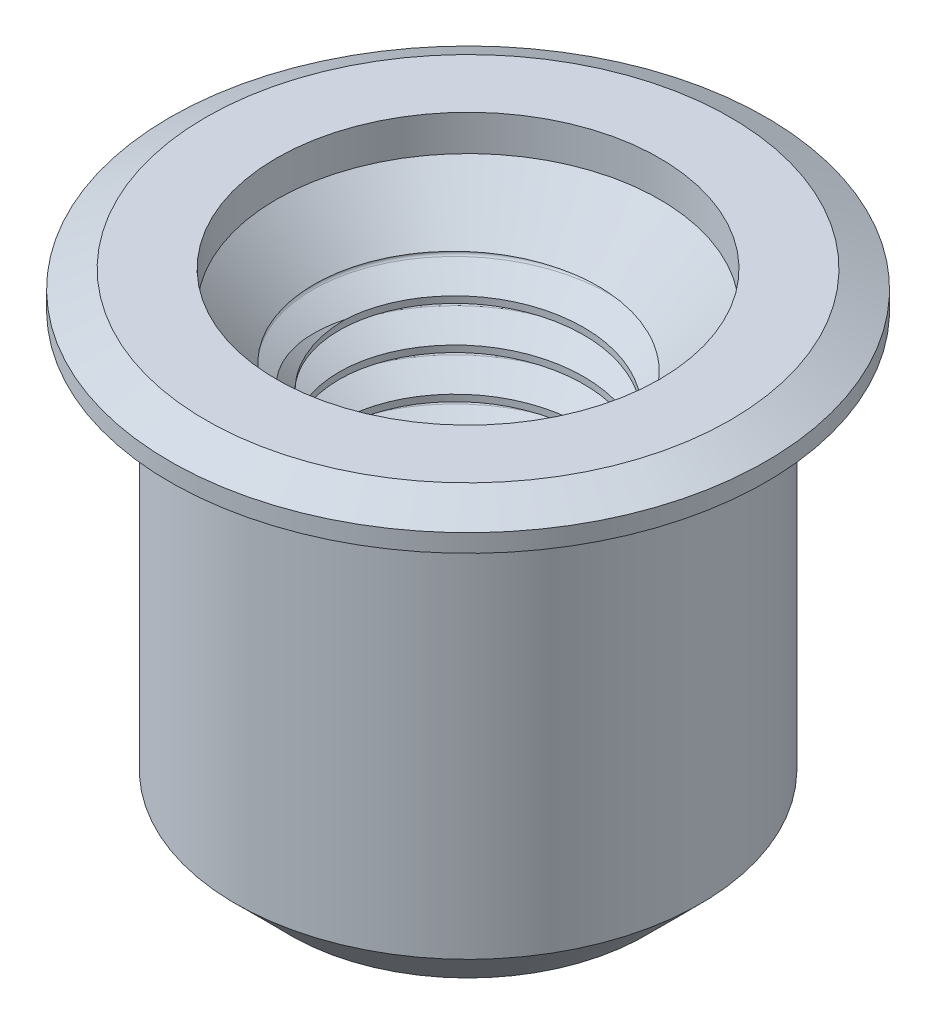
from build123d import *

# Parameters (mm, degrees)
CUT_SWEEP1_PITCH = 0.907142857


with BuildPart() as part:
    # Sketch1 → Revolve1 (revolve)
    with BuildSketch(Plane.XY):
        Polygon((-4.953, -9.241517857), (-3.780517857, -10.414), (-3.175, -10.414), (-2.608035714, -9.847035714), (-2.608035714, -2.236107143), (-4.082142857, -0.762), (-4.082142857, 0), (-5.588, 0), (-6.35, -0.381), (-6.35, -0.762), (-4.953, -0.762), align=None)
    revolve(axis=Axis((0, 0, 0), (0, -1, 0)))

    # Cut-Sweep1: the profile of Sketch4 screwed along a right-hand helix of 20.436459 turns, 8 arcs to a turn; built about Z, then put on its axis
    cut_sweep1_z = Axis((0, 0, 0), (0, 0, 1))
    cut_sweep1_corners = [(2.536692883, 0, 0.368526786), (2.536692883, 0, -0.481919643), (3.175, 0, -0.113392857), (3.207733698, 0, -0.056696429), (3.175, 0, 0)]
    with BuildLine(mode=Mode.PRIVATE) as cut_sweep1_profile:
        Line(cut_sweep1_corners[0], cut_sweep1_corners[1])
        Line(cut_sweep1_corners[1], cut_sweep1_corners[2])
        Line(cut_sweep1_corners[4], cut_sweep1_corners[0])
        ThreePointArc((3.175, 0, -0.113392857), (3.19896273, 0, -0.089430127), (3.207733698, 0, -0.056696429))
        ThreePointArc((3.207733698, 0, -0.056696429), (3.19896273, 0, -0.02396273), (3.175, 0, 0))
    cut_sweep1_cap = Face(cut_sweep1_profile.wire())
    cut_sweep1_arcs = [((3.175, 0, -0.113392857), (3.207733698, 0, -0.094494048), (3.207733698, 0, -0.056696429), (1, 0.86602540378445, 1)), ((3.207733698, 0, -0.056696429), (3.207733698, 0, -0.01889881), (3.175, 0, 0), (1, 0.86602540378445, 1))]  # start, shoulder, end, weights
    cut_sweep1_turn_angles = [0, 22.5, 45, 67.5, 90, 112.5, 135, 157.5, 180, 202.5, 225, 247.5, 270, 292.5, 315, 337.5, 360]
    cut_sweep1_turn_weights = [1, 0.9238795325112867, 1, 0.9238795325112867, 1, 0.9238795325112867, 1, 0.9238795325112867, 1, 0.9238795325112867, 1, 0.9238795325112867, 1, 0.9238795325112867, 1, 0.9238795325112867, 1]
    cut_sweep1_turn_rails = [Edge.make_bspline([Vector(p[0], p[1], 0).rotate(cut_sweep1_z, cut_sweep1_turn_angles[k]) / cut_sweep1_turn_weights[k] + Vector(0, 0, p[2] + CUT_SWEEP1_PITCH * cut_sweep1_turn_angles[k] / 360) for k in range(17)], [0, 0, 0, 1, 1, 2, 2, 3, 3, 4, 4, 5, 5, 6, 6, 7, 7, 8, 8, 8], 2, cut_sweep1_turn_weights) for p in cut_sweep1_corners]
    cut_sweep1_turn_sides = [*[Face.make_surface_from_curves(cut_sweep1_turn_rails[p[0]], cut_sweep1_turn_rails[p[1]]) for p in [(0, 1), (1, 2), (4, 0)]], *[Face.make_bezier_surface([[Vector(p[j][0], p[j][1], 0).rotate(cut_sweep1_z, cut_sweep1_turn_angles[2 * i + k]) / cut_sweep1_turn_weights[2 * i + k] + Vector(0, 0, p[j][2] + CUT_SWEEP1_PITCH * cut_sweep1_turn_angles[2 * i + k] / 360) for k in range(3)] for j in range(3)], [[p[3][j] * cut_sweep1_turn_weights[2 * i + k] for k in range(3)] for j in range(3)]) for p in cut_sweep1_arcs for i in range(8)]]
    cut_sweep1_last_angles = [7200, 7222.5, 7245, 7267.5, 7290, 7312.5, 7335, 7346.062697408, 7357.125394816]
    cut_sweep1_last_weights = [1, 0.9238795325112867, 1, 0.9238795325112867, 1, 0.9238795325112867, 1, 0.9814177980271717, 1]
    cut_sweep1_last_rails = [Edge.make_bspline([Vector(p[0], p[1], 0).rotate(cut_sweep1_z, cut_sweep1_last_angles[k]) / cut_sweep1_last_weights[k] + Vector(0, 0, p[2] + CUT_SWEEP1_PITCH * cut_sweep1_last_angles[k] / 360) for k in range(9)], [0, 0, 0, 1, 1, 2, 2, 3, 3, 4, 4, 4], 2, cut_sweep1_last_weights) for p in cut_sweep1_corners]
    cut_sweep1_last_sides = [*[Face.make_surface_from_curves(cut_sweep1_last_rails[p[0]], cut_sweep1_last_rails[p[1]]) for p in [(0, 1), (1, 2), (4, 0)]], *[Face.make_bezier_surface([[Vector(p[j][0], p[j][1], 0).rotate(cut_sweep1_z, cut_sweep1_last_angles[2 * i + k]) / cut_sweep1_last_weights[2 * i + k] + Vector(0, 0, p[j][2] + CUT_SWEEP1_PITCH * cut_sweep1_last_angles[2 * i + k] / 360) for k in range(3)] for j in range(3)], [[p[3][j] * cut_sweep1_last_weights[2 * i + k] for k in range(3)] for j in range(3)]) for p in cut_sweep1_arcs for i in range(4)]]
    cut_sweep1 = Plane(origin=(0, -10.414, 0), x_dir=(1, 0, 0), z_dir=(0, 1, 0)) * Solid(Shell([*[p.moved(Location((0, 0, CUT_SWEEP1_PITCH * i))) for i in range(20) for p in cut_sweep1_turn_sides], *cut_sweep1_last_sides, cut_sweep1_cap, cut_sweep1_cap.rotate(cut_sweep1_z, 7357.125394816).moved(Location((0, 0, CUT_SWEEP1_PITCH * 7357.125394816 / 360)))]))
    add(cut_sweep1, mode=Mode.SUBTRACT)


solid = part.part
